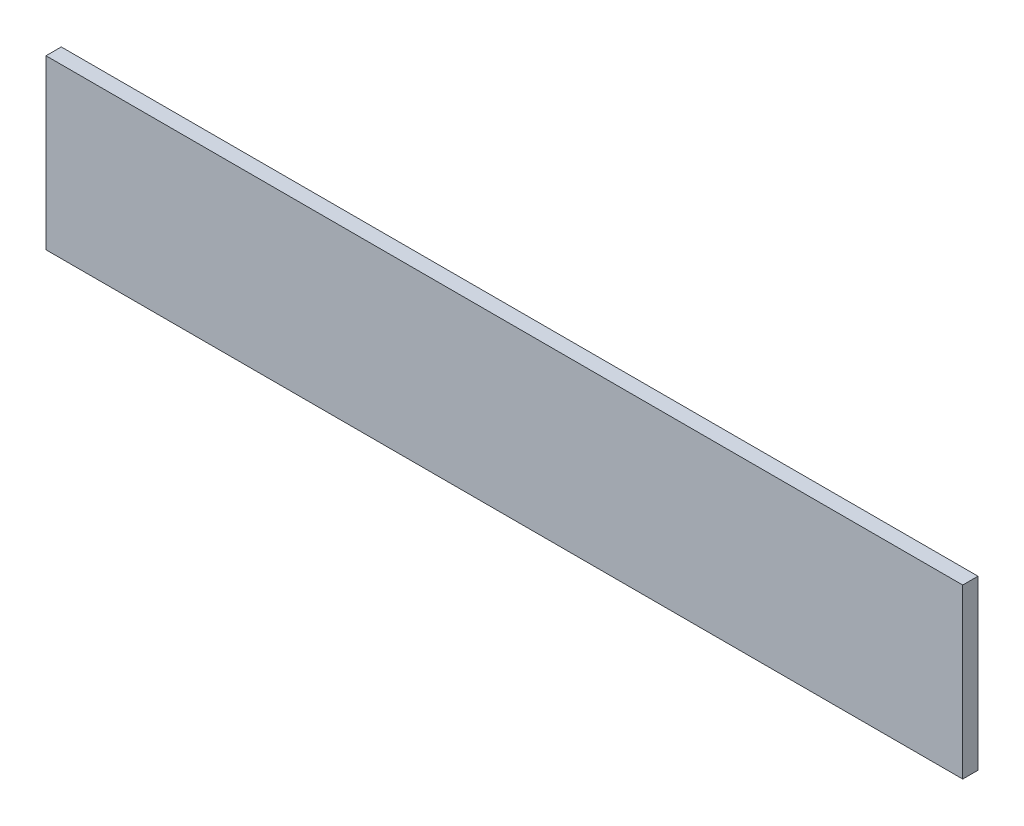
from build123d import *

# Parameters (mm, degrees)
ESQUISSE1_W        = 600
ESQUISSE1_H        = 110
BOSS_EXTRU_1_DEPTH = 10


with BuildPart() as part:
    # Esquisse1 → Boss.-Extru.1 (new body)
    with BuildSketch(Plane.XY):
        with Locations((300, 55)):
            Rectangle(ESQUISSE1_W, ESQUISSE1_H)
    extrude(amount=BOSS_EXTRU_1_DEPTH)


solid = part.part
